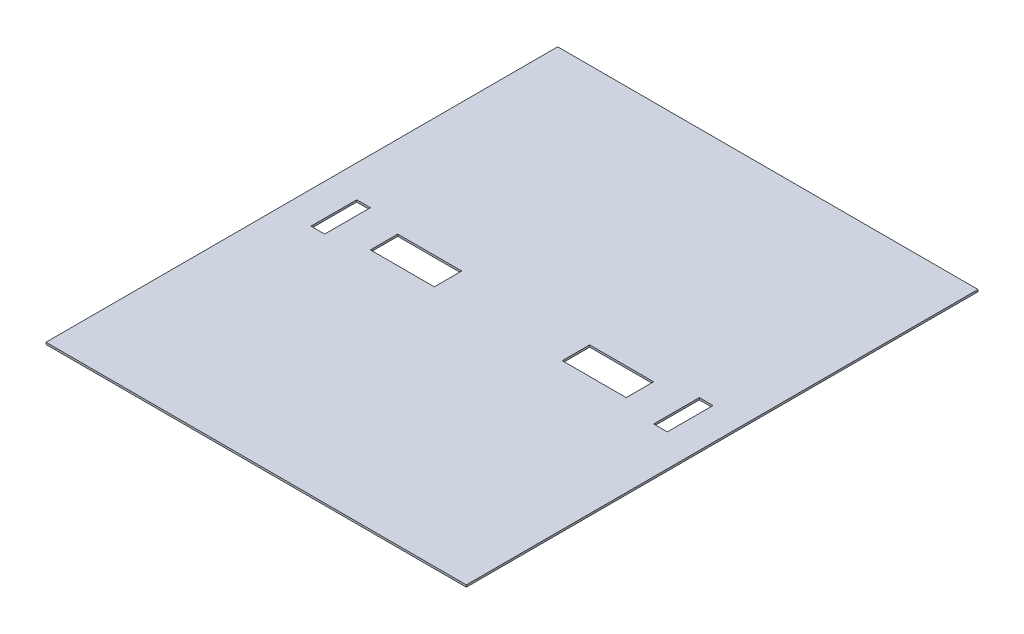
from build123d import *

# Parameters (mm, degrees)
SKETCH1_W           = 584.2
SKETCH1_H           = 711.2
BOSS_EXTRUDE1_DEPTH = 2.794
SKETCH3_W           = 19.05
SKETCH3_H           = 63.5
SKETCH3_W_2         = 88.9
SKETCH3_H_2         = 38.1
CUT_EXTRUDE1_DEPTH  = 461.197323369


with BuildPart() as part:
    # Sketch1 → Boss-Extrude1 (new body)
    with BuildSketch(Plane(origin=(0, -25.4, 330.2), x_dir=(1, 0, 0), z_dir=(0, 1, 0))):
        with Locations((0, 330.2)):
            Rectangle(SKETCH1_W, SKETCH1_H)
    extrude(amount=-BOSS_EXTRUDE1_DEPTH)

    # Sketch3 → Cut-Extrude1 (cut, through all)
    with BuildSketch(Plane(origin=(0, -28.194, 0), x_dir=(-1, 0, 0), z_dir=(0, -1, 0))):
        with Locations((238.125, 0)):
            Rectangle(SKETCH3_W, SKETCH3_H)
        with Locations((133.35, 0)):
            Rectangle(SKETCH3_W_2, SKETCH3_H_2)
    cut_extrude1 = extrude(amount=-CUT_EXTRUDE1_DEPTH, mode=Mode.SUBTRACT)

    # Mirror1: Cut-Extrude1 across plane
    add(cut_extrude1.mirror(Plane(origin=(0, 0, 0), x_dir=(0, 0, 1), z_dir=(1, 0, 0))), mode=Mode.SUBTRACT)


solid = part.part
